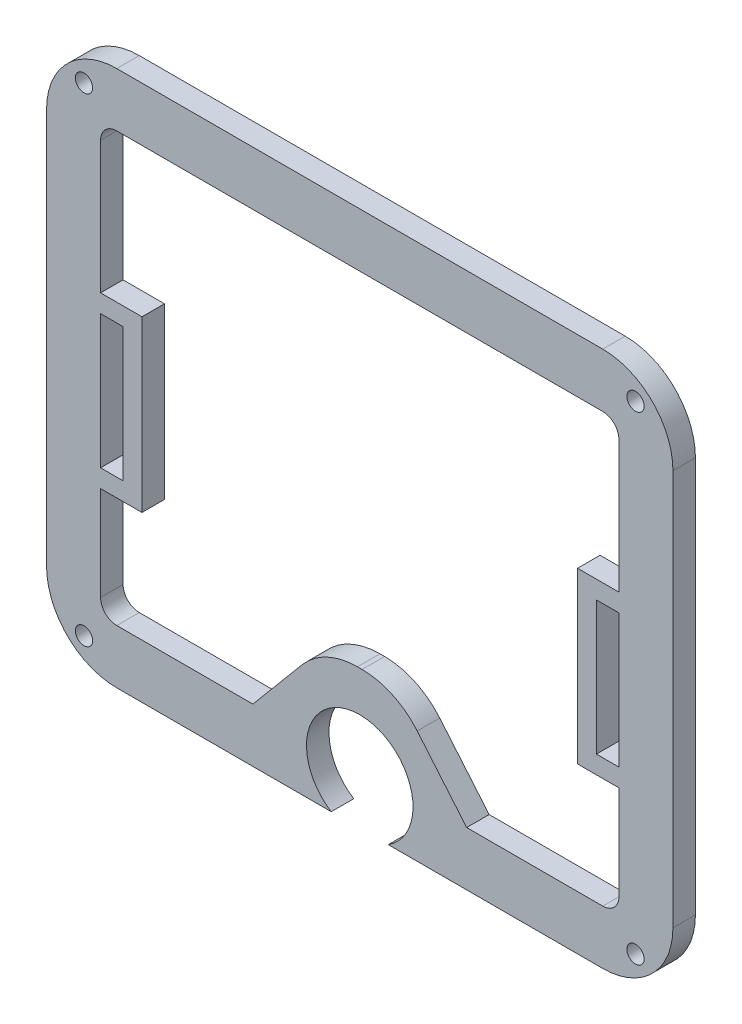
from build123d import *

# Parameters (mm, degrees)
SKETCH1_R           = 0.6096
BOSS_EXTRUDE1_DEPTH = 1.5875
SKETCH2_W           = 1.5875
SKETCH2_H           = 11.961096438
BOSS_EXTRUDE2_DEPTH = 2.921
CUT_EXTRUDE1_DEPTH  = 1.5875


with BuildPart() as part:
    # Sketch1 → Boss-Extrude1 (new body)
    with BuildSketch(Plane.XY):
        with BuildLine():
            Line((-17.145, -18.923), (-2.01269959, -18.923))
            ThreePointArc((-2.01269959, -18.923), (0, -11.9888), (2.01269959, -18.923))
            Line((2.01269959, -18.923), (17.145, -18.923))
            ThreePointArc((17.145, -18.923), (20.647299887, -17.472299887), (22.098, -13.97))
            Line((22.098, -13.97), (22.098, 13.97))
            ThreePointArc((22.098, 13.97), (20.647299887, 17.472299887), (17.145, 18.923))
            Line((17.145, 18.923), (-17.145, 18.923))
            ThreePointArc((-17.145, 18.923), (-20.647299887, 17.472299887), (-22.098, 13.97))
            Line((-22.098, 13.97), (-22.098, -13.97))
            ThreePointArc((-22.098, -13.97), (-20.647299887, -17.472299887), (-17.145, -18.923))
        make_face()
        with Locations((-19.457528855, 16.891)):
            Circle(SKETCH1_R, mode=Mode.SUBTRACT)
        with Locations((19.457528855, 16.891)):
            Circle(SKETCH1_R, mode=Mode.SUBTRACT)
        with Locations((19.457528855, -16.891)):
            Circle(SKETCH1_R, mode=Mode.SUBTRACT)
        with Locations((-19.457528855, -16.891)):
            Circle(SKETCH1_R, mode=Mode.SUBTRACT)
        with BuildLine():
            Line((-18.288, 13.97), (-18.288, -13.97))
            ThreePointArc((-18.288, -13.97), (-17.953223051, -14.778223051), (-17.145, -15.113))
            Line((-17.145, -15.113), (-7.542517063, -15.113))
            Line((-7.542517063, -15.113), (-4.056594232, -10.958638943))
            ThreePointArc((-4.056594232, -10.958638943), (-2.31198923, -9.619956442), (-0.165088461, -9.144))
            Line((-0.165088461, -9.144), (0.165088461, -9.144))
            ThreePointArc((0.165088461, -9.144), (2.31198923, -9.619956442), (4.056594232, -10.958638943))
            Line((4.056594232, -10.958638943), (7.542517063, -15.113))
            Line((7.542517063, -15.113), (17.145, -15.113))
            ThreePointArc((17.145, -15.113), (17.953223051, -14.778223051), (18.288, -13.97))
            Line((18.288, -13.97), (18.288, 13.97))
            ThreePointArc((18.288, 13.97), (17.953223051, 14.778223051), (17.145, 15.113))
            Line((17.145, 15.113), (-17.145, 15.113))
            ThreePointArc((-17.145, 15.113), (-17.953223051, 14.778223051), (-18.288, 13.97))
        make_face(mode=Mode.SUBTRACT)
    extrude(amount=BOSS_EXTRUDE1_DEPTH)

    # Sketch2 → Boss-Extrude2 (add)
    with BuildSketch(Plane(origin=(-18.288, 0, 0), x_dir=(0, 0, -1), z_dir=(1, 0, 0))):
        with Locations((-0.79375, -1.336105317)):
            Rectangle(SKETCH2_W, SKETCH2_H)
    boss_extrude2 = extrude(amount=BOSS_EXTRUDE2_DEPTH)

    # Sketch2<3> → Cut-Extrude1 (cut)
    with BuildSketch(Plane(origin=(-18.288, 0, 0), x_dir=(0, 0, -1), z_dir=(1, 0, 0))):
        Polygon((0, 1.469264578), (0, 3.374442902), (-1.5875, 3.374442902), (-1.5875, -6.046653536), (0, -6.046653536), align=None)
    cut_extrude1 = extrude(amount=CUT_EXTRUDE1_DEPTH, mode=Mode.SUBTRACT)

    # Mirror1: Boss-Extrude2, Cut-Extrude1 across plane
    add(boss_extrude2.mirror(Plane(origin=(0, 0, 0), x_dir=(0, 0, 1), z_dir=(1, 0, 0))))
    add(cut_extrude1.mirror(Plane(origin=(0, 0, 0), x_dir=(0, 0, 1), z_dir=(1, 0, 0))), mode=Mode.SUBTRACT)


solid = part.part
